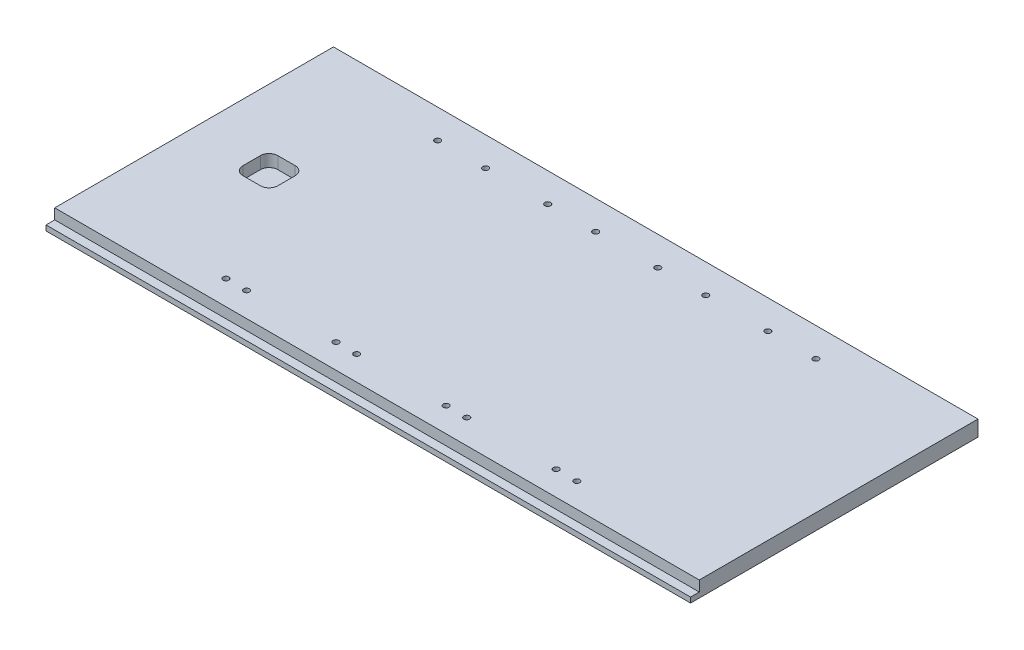
from build123d import *

# Parameters (mm, degrees)
SKETCH3_W           = 469.9
SKETCH3_H           = 209.55
BOSS_EXTRUDE1_DEPTH = 11.43
SKETCH4_R           = 2.1
CUT_EXTRUDE3_DEPTH  = 258.507180531
SKETCH5_R           = 2.1
CUT_EXTRUDE4_DEPTH  = 258.507180531
SKETCH7_W           = 25.4
SKETCH7_H           = 25.4
CUT_EXTRUDE5_DEPTH  = 8.89
CUT_EXTRUDE6_REACH  = 483.575
SKETCH8_W           = 6.35
SKETCH8_H           = 7.62
FILLET1_R           = 6.35


with BuildPart() as part:
    # Sketch3 → Boss-Extrude1 (new body)
    with BuildSketch(Plane(origin=(0, 0, 0), x_dir=(1, 0, 0), z_dir=(0, 1, 0))):
        Rectangle(SKETCH3_W, SKETCH3_H)
    extrude(amount=BOSS_EXTRUDE1_DEPTH)

    # Sketch4 → Cut-Extrude3 (cut, through all)
    with BuildSketch(Plane(origin=(0, 11.43, 0), x_dir=(1, 0, 0), z_dir=(0, 1, 0))):
        with Locations((-102.9, 83.65)):
            Circle(SKETCH4_R)
        with Locations((-22.65, 83.65)):
            Circle(SKETCH4_R)
        with Locations((57.6, 83.65)):
            Circle(SKETCH4_R)
        with Locations((137.85, 83.65)):
            Circle(SKETCH4_R)
        with Locations((112.85, -80.65)):
            Circle(SKETCH4_R)
        with Locations((32.6, -80.65)):
            Circle(SKETCH4_R)
        with Locations((-47.65, -80.65)):
            Circle(SKETCH4_R)
        with Locations((-127.9, -80.65)):
            Circle(SKETCH4_R)
    extrude(amount=-CUT_EXTRUDE3_DEPTH, mode=Mode.SUBTRACT)

    # Sketch5 → Cut-Extrude4 (cut, through all)
    with BuildSketch(Plane(origin=(0, 11.43, 0), x_dir=(1, 0, 0), z_dir=(0, 1, 0))):
        with Locations((-137.85, 83.65)):
            Circle(SKETCH5_R)
        with Locations((-57.6, 83.65)):
            Circle(SKETCH5_R)
        with Locations((22.65, 83.65)):
            Circle(SKETCH5_R)
        with Locations((102.9, 83.65)):
            Circle(SKETCH5_R)
        with Locations((-112.85, -80.65)):
            Circle(SKETCH5_R)
        with Locations((-32.6, -80.65)):
            Circle(SKETCH5_R)
        with Locations((47.65, -80.65)):
            Circle(SKETCH5_R)
        with Locations((127.9, -80.65)):
            Circle(SKETCH5_R)
    extrude(amount=-CUT_EXTRUDE4_DEPTH, mode=Mode.SUBTRACT)

    # Sketch7 → Cut-Extrude5 (cut)
    with BuildSketch(Plane(origin=(0, 11.43, 0), x_dir=(1, 0, 0), z_dir=(0, 1, 0))):
        with Locations((-180.25, 3.175)):
            Rectangle(SKETCH7_W, SKETCH7_H)
    extrude(amount=-CUT_EXTRUDE5_DEPTH, mode=Mode.SUBTRACT)

    # Sketch8 → Cut-Extrude6 (cut, up to next)
    with BuildSketch(Plane.ZY.offset(234.95), mode=Mode.PRIVATE) as cut_extrude6_sk1:
        with Locations((101.6, 7.62)):
            Rectangle(SKETCH8_W, SKETCH8_H)
    cut_extrude6_tool1 = extrude(cut_extrude6_sk1.sketch, amount=-CUT_EXTRUDE6_REACH, mode=Mode.PRIVATE) & part.part
    add(cut_extrude6_tool1.solids().sort_by_distance((-234.95, 7.62, 101.6))[0], mode=Mode.SUBTRACT)

    # Fillet1
    fillet1_edges = [part.edges().sort_by_distance(p)[0] for p in [
        (-167.55, 6.985, 9.525),
        (-192.95, 6.985, 9.525),
        (-192.95, 6.985, -15.875),
        (-167.55, 6.985, -15.875),
    ]]
    fillet(fillet1_edges, radius=FILLET1_R)


solid = part.part
